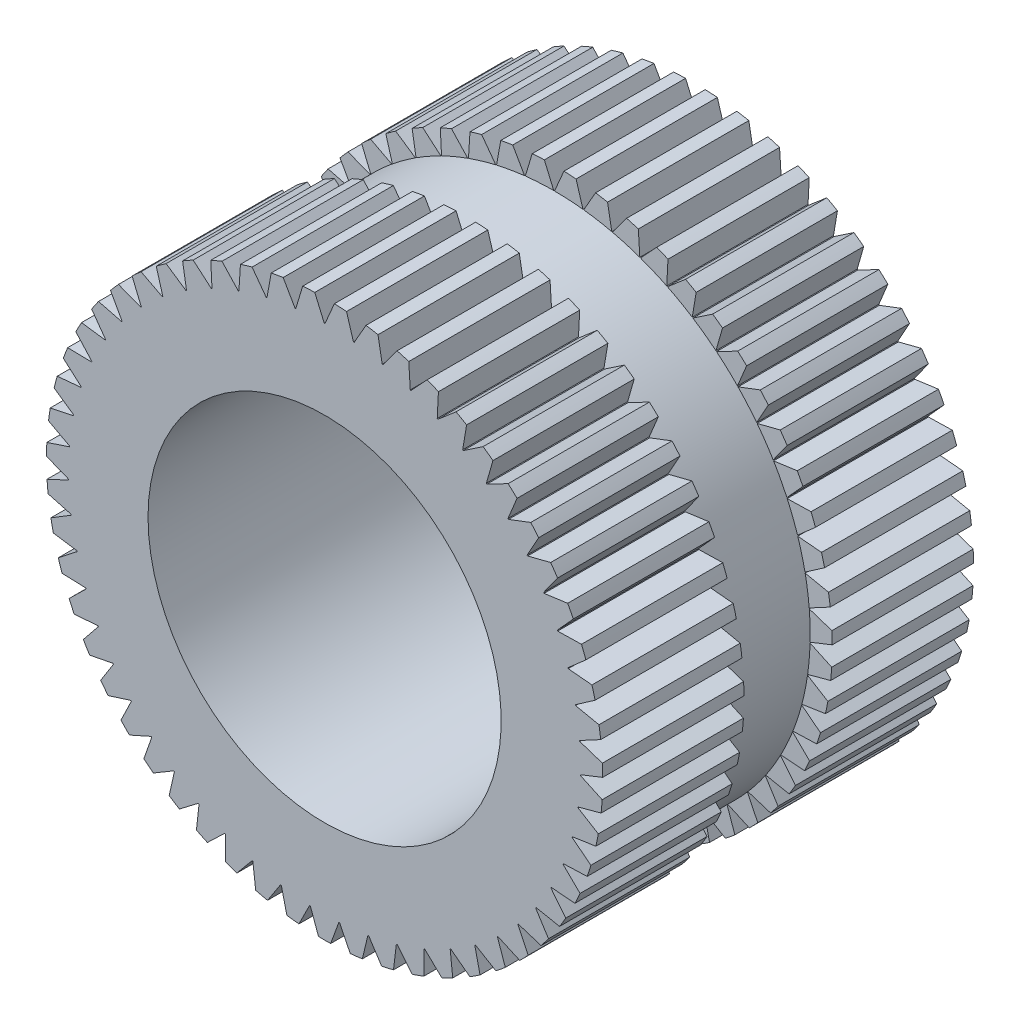
from build123d import *

# Parameters (mm, degrees)
BOSS_EXTRUDE1_DEPTH      = 1.6
SKETCH2_R                = 2.9
BOSS_EXTRUDE2_DEPTH      = 1
BOSS_EXTRUDE3_DEPTH      = 1.6
F_4_0_4_DIAMETER_HOLE1_D = 4


with BuildPart() as part:
    # Sketch1 → Boss-Extrude1 (new body)
    with BuildSketch(Plane.XY.offset(2.1)):
        with BuildLine():
            Line((-2.843098985, 0.571653881), (-3.107391148, 0.516352837))
            ThreePointArc((-3.107391148, 0.516352837), (-3.117937542, 0.448291741), (-3.126993378, 0.380016334))
            Line((-3.126993378, 0.380016334), (-2.888987009, 0.252495664))
            ThreePointArc((-2.888987009, 0.252495664), (-2.88936202, 0.248167525), (-2.889730546, 0.243838828))
            Line((-2.889730546, 0.243838828), (-3.145996138, 0.158771215))
            ThreePointArc((-3.145996138, 0.158771215), (-3.148715407, 0.08995156), (-3.149929405, 0.021088903))
            Line((-3.149929405, 0.021088903), (-2.898938164, -0.078469872))
            ThreePointArc((-2.898938164, -0.078469872), (-2.898817359, -0.082812547), (-2.898690049, -0.087155037))
            Line((-2.898690049, -0.087155037), (-3.143588257, -0.200880234))
            ThreePointArc((-3.143588257, -0.200880234), (-3.138444952, -0.269561277), (-3.131801286, -0.338113454))
            Line((-3.131801286, -0.338113454), (-2.871097227, -0.408412433))
            ThreePointArc((-2.871097227, -0.408412433), (-2.870482181, -0.412713031), (-2.869860694, -0.417012703))
            Line((-2.869860694, -0.417012703), (-3.100198896, -0.557912901))
            ThreePointArc((-3.100198896, -0.557912901), (-3.087260067, -0.62555997), (-3.072845347, -0.692907985))
            Line((-3.072845347, -0.692907985), (-2.805827146, -0.733030713))
            ThreePointArc((-2.805827146, -0.733030713), (-2.804725879, -0.737233169), (-2.803618317, -0.74143397))
            Line((-2.803618317, -0.74143397), (-3.016393701, -0.90767232))
            ThreePointArc((-3.016393701, -0.90767232), (-2.995828026, -0.973403532), (-2.973830169, -1.038669401))
            Line((-2.973830169, -1.038669401), (-2.703978818, -1.048092817))
            ThreePointArc((-2.703978818, -1.048092817), (-2.702405685, -1.052142346), (-2.700826487, -1.056189512))
            Line((-2.700826487, -1.056189512), (-2.893265201, -1.245598842))
            ThreePointArc((-2.893265201, -1.245598842), (-2.865340785, -1.308557291), (-2.836046568, -1.370890172))
            Line((-2.836046568, -1.370890172), (-2.56687999, -1.349491429))
            ThreePointArc((-2.56687999, -1.349491429), (-2.5648555, -1.353335237), (-2.562825254, -1.357176009))
            Line((-2.562825254, -1.357176009), (-2.732418565, -1.567287079))
            ThreePointArc((-2.732418565, -1.567287079), (-2.697499445, -1.626652004), (-2.661290762, -1.685239294))
            Line((-2.661290762, -1.685239294), (-2.396317956, -1.633297356))
            ThreePointArc((-2.396317956, -1.633297356), (-2.393868501, -1.636885335), (-2.391413674, -1.64046964))
            Line((-2.391413674, -1.64046964), (-2.535950674, -1.868543331))
            ThreePointArc((-2.535950674, -1.868543331), (-2.494492075, -1.923540821), (-2.451840962, -1.977618745))
            Line((-2.451840962, -1.977618745), (-2.194516253, -1.895810754))
            ThreePointArc((-2.194516253, -1.895810754), (-2.191673766, -1.899096128), (-2.188826359, -1.902377241))
            Line((-2.188826359, -1.902377241), (-2.306422787, -2.145440264))
            ThreePointArc((-2.306422787, -2.145440264), (-2.258965185, -2.195353341), (-2.210427664, -2.24421691))
            Line((-2.210427664, -2.24421691), (-1.964105675, -2.133609359))
            ThreePointArc((-1.964105675, -2.133609359), (-1.960907211, -2.1365493), (-1.957704346, -2.139484446))
            Line((-1.957704346, -2.139484446), (-2.046827153, -2.394368102))
            ThreePointArc((-2.046827153, -2.394368102), (-1.993989229, -2.438546074), (-1.940198062, -2.481558276))
            Line((-1.940198062, -2.481558276), (-1.708089975, -2.343593104))
            ThreePointArc((-1.708089975, -2.343593104), (-1.704577232, -2.346149284), (-1.701060663, -2.348700198))
            Line((-1.701060663, -2.348700198), (-1.760547996, -2.61208169))
            ThreePointArc((-1.760547996, -2.61208169), (-1.703018575, -2.649948628), (-1.644675011, -2.686548735))
            Line((-1.644675011, -2.686548735), (-1.429806711, -2.523024528))
            ThreePointArc((-1.429806711, -2.523024528), (-1.426025481, -2.525163624), (-1.422241052, -2.527297052))
            Line((-1.422241052, -2.527297052), (-1.451317403, -2.795742798))
            ThreePointArc((-1.451317403, -2.795742798), (-1.389846469, -2.82680505), (-1.327711106, -2.856515923))
            Line((-1.327711106, -2.856515923), (-1.132883729, -2.669564469))
            ThreePointArc((-1.132883729, -2.669564469), (-1.128883308, -2.671258594), (-1.124880354, -2.672946724))
            Line((-1.124880354, -2.672946724), (-1.123166669, -2.942957124))
            ThreePointArc((-1.123166669, -2.942957124), (-1.058555589, -2.966809745), (-0.993438456, -2.989244057))
            Line((-0.993438456, -2.989244057), (-0.821191875, -2.781302555))
            ThreePointArc((-0.821191875, -2.781302555), (-0.817024415, -2.782529623), (-0.812855121, -2.783750447))
            Line((-0.812855121, -2.783750447), (-0.78037374, -3.051805503))
            ThreePointArc((-0.78037374, -3.051805503), (-0.713464817, -3.068137538), (-0.646214817, -3.083002824))
            Line((-0.646214817, -3.083002824), (-0.49879453, -2.856782109))
            ThreePointArc((-0.49879453, -2.856782109), (-0.494514359, -2.857526124), (-0.490233078, -2.858263726))
            Line((-0.490233078, -2.858263726), (-0.427407445, -3.12086893))
            ThreePointArc((-0.427407445, -3.12086893), (-0.359072941, -3.129467466), (-0.290566779, -3.136569933))
            Line((-0.290566779, -3.136569933), (-0.169894635, -2.895019139))
            ThreePointArc((-0.169894635, -2.895019139), (-0.165557552, -2.895270401), (-0.161220097, -2.895515167))
            Line((-0.161220097, -2.895515167), (-0.068869241, -3.149247057))
            ThreePointArc((-0.068869241, -3.149247057), (0, -3.15), (0.068869241, -3.149247057))
            Line((0.068869241, -3.149247057), (0.161220097, -2.895515167))
            ThreePointArc((0.161220097, -2.895515167), (0.165557552, -2.895270401), (0.169894635, -2.895019139))
            Line((0.169894635, -2.895019139), (0.290566779, -3.136569933))
            ThreePointArc((0.290566779, -3.136569933), (0.359072941, -3.129467466), (0.427407445, -3.12086893))
            Line((0.427407445, -3.12086893), (0.490233078, -2.858263726))
            ThreePointArc((0.490233078, -2.858263726), (0.494514359, -2.857526124), (0.49879453, -2.856782109))
            Line((0.49879453, -2.856782109), (0.646214817, -3.083002824))
            ThreePointArc((0.646214817, -3.083002824), (0.713464817, -3.068137538), (0.78037374, -3.051805503))
            Line((0.78037374, -3.051805503), (0.812855121, -2.783750447))
            ThreePointArc((0.812855121, -2.783750447), (0.817024415, -2.782529623), (0.821191875, -2.781302555))
            Line((0.821191875, -2.781302555), (0.993438456, -2.989244057))
            ThreePointArc((0.993438456, -2.989244057), (1.058555589, -2.966809745), (1.123166669, -2.942957124))
            Line((1.123166669, -2.942957124), (1.124880354, -2.672946724))
            ThreePointArc((1.124880354, -2.672946724), (1.128883308, -2.671258594), (1.132883729, -2.669564469))
            Line((1.132883729, -2.669564469), (1.327711106, -2.856515923))
            ThreePointArc((1.327711106, -2.856515923), (1.389846469, -2.82680505), (1.451317403, -2.795742798))
            Line((1.451317403, -2.795742798), (1.422241052, -2.527297052))
            ThreePointArc((1.422241052, -2.527297052), (1.426025481, -2.525163624), (1.429806711, -2.523024528))
            Line((1.429806711, -2.523024528), (1.644675011, -2.686548735))
            ThreePointArc((1.644675011, -2.686548735), (1.703018575, -2.649948628), (1.760547996, -2.61208169))
            Line((1.760547996, -2.61208169), (1.701060663, -2.348700198))
            ThreePointArc((1.701060663, -2.348700198), (1.704577232, -2.346149284), (1.708089975, -2.343593104))
            Line((1.708089975, -2.343593104), (1.940198062, -2.481558276))
            ThreePointArc((1.940198062, -2.481558276), (1.993989229, -2.438546074), (2.046827153, -2.394368102))
            Line((2.046827153, -2.394368102), (1.957704346, -2.139484446))
            ThreePointArc((1.957704346, -2.139484446), (1.960907211, -2.1365493), (1.964105675, -2.133609359))
            Line((1.964105675, -2.133609359), (2.210427664, -2.24421691))
            ThreePointArc((2.210427664, -2.24421691), (2.258965185, -2.195353341), (2.306422787, -2.145440264))
            Line((2.306422787, -2.145440264), (2.188826359, -1.902377241))
            ThreePointArc((2.188826359, -1.902377241), (2.191673766, -1.899096128), (2.194516253, -1.895810754))
            Line((2.194516253, -1.895810754), (2.451840962, -1.977618745))
            ThreePointArc((2.451840962, -1.977618745), (2.494492075, -1.923540821), (2.535950674, -1.868543331))
            Line((2.535950674, -1.868543331), (2.391413674, -1.64046964))
            ThreePointArc((2.391413674, -1.64046964), (2.393868501, -1.636885335), (2.396317956, -1.633297356))
            Line((2.396317956, -1.633297356), (2.661290762, -1.685239294))
            ThreePointArc((2.661290762, -1.685239294), (2.697499445, -1.626652004), (2.732418565, -1.567287079))
            Line((2.732418565, -1.567287079), (2.562825254, -1.357176009))
            ThreePointArc((2.562825254, -1.357176009), (2.5648555, -1.353335237), (2.56687999, -1.349491429))
            Line((2.56687999, -1.349491429), (2.836046568, -1.370890172))
            ThreePointArc((2.836046568, -1.370890172), (2.865340785, -1.308557291), (2.893265201, -1.245598842))
            Line((2.893265201, -1.245598842), (2.700826487, -1.056189512))
            ThreePointArc((2.700826487, -1.056189512), (2.702405685, -1.052142346), (2.703978818, -1.048092817))
            Line((2.703978818, -1.048092817), (2.973830169, -1.038669401))
            ThreePointArc((2.973830169, -1.038669401), (2.995828026, -0.973403532), (3.016393701, -0.90767232))
            Line((3.016393701, -0.90767232), (2.803618317, -0.74143397))
            ThreePointArc((2.803618317, -0.74143397), (2.804725879, -0.737233169), (2.805827146, -0.733030713))
            Line((2.805827146, -0.733030713), (3.072845347, -0.692907985))
            ThreePointArc((3.072845347, -0.692907985), (3.087260067, -0.62555997), (3.100198896, -0.557912901))
            Line((3.100198896, -0.557912901), (2.869860694, -0.417012703))
            ThreePointArc((2.869860694, -0.417012703), (2.870482181, -0.412713031), (2.871097227, -0.408412433))
            Line((2.871097227, -0.408412433), (3.131801286, -0.338113454))
            ThreePointArc((3.131801286, -0.338113454), (3.138444952, -0.269561277), (3.143588257, -0.200880234))
            Line((3.143588257, -0.200880234), (2.898690049, -0.087155037))
            ThreePointArc((2.898690049, -0.087155037), (2.898817359, -0.082812547), (2.898938164, -0.078469872))
            Line((2.898938164, -0.078469872), (3.149929405, 0.021088903))
            ThreePointArc((3.149929405, 0.021088903), (3.148715407, 0.08995156), (3.145996138, 0.158771215))
            Line((3.145996138, 0.158771215), (2.889730546, 0.243838828))
            ThreePointArc((2.889730546, 0.243838828), (2.88936202, 0.248167525), (2.888987009, 0.252495664))
            Line((2.888987009, 0.252495664), (3.126993378, 0.380016334))
            ThreePointArc((3.126993378, 0.380016334), (3.117937542, 0.448291741), (3.107391148, 0.516352837))
            Line((3.107391148, 0.516352837), (2.843098985, 0.571653881))
            ThreePointArc((2.843098985, 0.571653881), (2.842239427, 0.575912353), (2.841373491, 0.580169533))
            Line((2.841373491, 0.580169533), (3.06329221, 0.733989671))
            ThreePointArc((3.06329221, 0.733989671), (3.046512592, 0.800787753), (3.028276562, 0.867203011))
            Line((3.028276562, 0.867203011), (2.759403282, 0.892016552))
            ThreePointArc((2.759403282, 0.892016552), (2.758063897, 0.896149284), (2.756718323, 0.900280005))
            Line((2.756718323, 0.900280005), (2.959656343, 1.07839433))
            ThreePointArc((2.959656343, 1.07839433), (2.935371692, 1.142844272), (2.90968376, 1.206747867))
            Line((2.90968376, 1.206747867), (2.639734537, 1.200750422))
            ThreePointArc((2.639734537, 1.200750422), (2.637932787, 1.204703538), (2.636125117, 1.20865395))
            Line((2.636125117, 1.20865395), (2.81743683, 1.40874047))
            ThreePointArc((2.81743683, 1.40874047), (2.785963733, 1.470002068), (2.753158781, 1.530560919))
            Line((2.753158781, 1.530560919), (2.485652815, 1.493830675))
            ThreePointArc((2.485652815, 1.493830675), (2.483412188, 1.497552639), (2.481165988, 1.501271242))
            Line((2.481165988, 1.501271242), (2.638487718, 1.720721523))
            ThreePointArc((2.638487718, 1.720721523), (2.600236475, 1.777996139), (2.560742166, 1.834420769))
            Line((2.560742166, 1.834420769), (2.299166807, 1.76743656))
            ThreePointArc((2.299166807, 1.76743656), (2.296516513, 1.770878851), (2.293861066, 1.774317168))
            Line((2.293861066, 1.774317168), (2.425141885, 2.01027034))
            ThreePointArc((2.425141885, 2.01027034), (2.380611159, 2.062811312), (2.334942361, 2.114366139))
            Line((2.334942361, 2.114366139), (2.082707644, 2.018001207))
            ThreePointArc((2.082707644, 2.018001207), (2.079682234, 2.021118949), (2.076652157, 2.024232156))
            Line((2.076652157, 2.024232156), (2.180180618, 2.273612208))
            ThreePointArc((2.180180618, 2.273612208), (2.129950936, 2.320734584), (2.078703012, 2.366747513))
            Line((2.078703012, 2.366747513), (1.839097202, 2.242258121))
            ThreePointArc((1.839097202, 2.242258121), (1.835736116, 2.245010671), (1.832370911, 2.247758182))
            Line((1.832370911, 2.247758182), (1.906797362, 2.507314065))
            ThreePointArc((1.906797362, 2.507314065), (1.851523545, 2.548403532), (1.79536459, 2.588274713))
            Line((1.79536459, 2.588274713), (1.571511315, 2.437283773))
            ThreePointArc((1.571511315, 2.437283773), (1.567858371, 2.439635245), (1.564201908, 2.441981243))
            Line((1.564201908, 2.441981243), (1.608556087, 2.708329248))
            ThreePointArc((1.608556087, 2.708329248), (1.548958713, 2.742850143), (1.488620844, 2.776059794))
            Line((1.488620844, 2.776059794), (1.283438375, 2.600535702))
            ThreePointArc((1.283438375, 2.600535702), (1.279541194, 2.602455443), (1.275641141, 2.604369344))
            Line((1.275641141, 2.604369344), (1.289344824, 2.874037217))
            ThreePointArc((1.289344824, 2.874037217), (1.226200835, 2.901539507), (1.16247065, 2.927654691))
            Line((1.16247065, 2.927654691), (0.978633852, 2.729885672))
            ThreePointArc((0.978633852, 2.729885672), (0.97454324, 2.731348655), (0.970450441, 2.732805507))
            Line((0.970450441, 2.732805507), (0.953324978, 3.002277716))
            ThreePointArc((0.953324978, 3.002277716), (0.887457554, 3.022402867), (0.821165873, 3.041083131))
            Line((0.821165873, 3.041083131), (0.661071341, 2.823647407))
            ThreePointArc((0.661071341, 2.823647407), (0.656840626, 2.824634559), (0.652608436, 2.825615372))
            Line((0.652608436, 2.825615372), (0.604877084, 3.091378934))
            ThreePointArc((0.604877084, 3.091378934), (0.537144907, 3.103864583), (0.469155943, 3.114866402))
            Line((0.469155943, 3.114866402), (0.334890754, 2.880598581))
            ThreePointArc((0.334890754, 2.880598581), (0.330575089, 2.881097033), (0.326258681, 2.881589019))
            Line((0.326258681, 2.881589019), (0.248543692, 3.1401793))
            ThreePointArc((0.248543692, 3.1401793), (0.179829754, 3.144862677), (0.111029847, 3.148042626))
            Line((0.111029847, 3.148042626), (0.004344354, 2.899996746))
            ThreePointArc((0.004344354, 2.899996746), (0, 2.9), (-0.004344354, 2.899996746))
            Line((-0.004344354, 2.899996746), (-0.111029847, 3.148042626))
            ThreePointArc((-0.111029847, 3.148042626), (-0.179829754, 3.144862677), (-0.248543692, 3.1401793))
            Line((-0.248543692, 3.1401793), (-0.326258681, 2.881589019))
            ThreePointArc((-0.326258681, 2.881589019), (-0.330575089, 2.881097033), (-0.334890754, 2.880598581))
            Line((-0.334890754, 2.880598581), (-0.469155943, 3.114866402))
            ThreePointArc((-0.469155943, 3.114866402), (-0.537144907, 3.103864583), (-0.604877084, 3.091378934))
            Line((-0.604877084, 3.091378934), (-0.652608436, 2.825615372))
            ThreePointArc((-0.652608436, 2.825615372), (-0.656840626, 2.824634559), (-0.661071341, 2.823647407))
            Line((-0.661071341, 2.823647407), (-0.821165873, 3.041083131))
            ThreePointArc((-0.821165873, 3.041083131), (-0.887457554, 3.022402867), (-0.953324978, 3.002277716))
            Line((-0.953324978, 3.002277716), (-0.970450441, 2.732805507))
            ThreePointArc((-0.970450441, 2.732805507), (-0.97454324, 2.731348655), (-0.978633852, 2.729885672))
            Line((-0.978633852, 2.729885672), (-1.16247065, 2.927654691))
            ThreePointArc((-1.16247065, 2.927654691), (-1.226200835, 2.901539507), (-1.289344824, 2.874037217))
            Line((-1.289344824, 2.874037217), (-1.275641141, 2.604369344))
            ThreePointArc((-1.275641141, 2.604369344), (-1.279541194, 2.602455443), (-1.283438375, 2.600535702))
            Line((-1.283438375, 2.600535702), (-1.488620844, 2.776059794))
            ThreePointArc((-1.488620844, 2.776059794), (-1.548958713, 2.742850143), (-1.608556087, 2.708329248))
            Line((-1.608556087, 2.708329248), (-1.564201908, 2.441981243))
            ThreePointArc((-1.564201908, 2.441981243), (-1.567858371, 2.439635245), (-1.571511315, 2.437283773))
            Line((-1.571511315, 2.437283773), (-1.79536459, 2.588274713))
            ThreePointArc((-1.79536459, 2.588274713), (-1.851523545, 2.548403532), (-1.906797362, 2.507314065))
            Line((-1.906797362, 2.507314065), (-1.832370911, 2.247758182))
            ThreePointArc((-1.832370911, 2.247758182), (-1.835736116, 2.245010671), (-1.839097202, 2.242258121))
            Line((-1.839097202, 2.242258121), (-2.078703012, 2.366747513))
            ThreePointArc((-2.078703012, 2.366747513), (-2.129950936, 2.320734584), (-2.180180618, 2.273612208))
            Line((-2.180180618, 2.273612208), (-2.076652157, 2.024232156))
            ThreePointArc((-2.076652157, 2.024232156), (-2.079682234, 2.021118949), (-2.082707644, 2.018001207))
            Line((-2.082707644, 2.018001207), (-2.334942361, 2.114366139))
            ThreePointArc((-2.334942361, 2.114366139), (-2.380611159, 2.062811312), (-2.425141885, 2.01027034))
            Line((-2.425141885, 2.01027034), (-2.293861066, 1.774317168))
            ThreePointArc((-2.293861066, 1.774317168), (-2.296516513, 1.770878851), (-2.299166807, 1.76743656))
            Line((-2.299166807, 1.76743656), (-2.560742166, 1.834420769))
            ThreePointArc((-2.560742166, 1.834420769), (-2.600236475, 1.777996139), (-2.638487718, 1.720721523))
            Line((-2.638487718, 1.720721523), (-2.481165988, 1.501271242))
            ThreePointArc((-2.481165988, 1.501271242), (-2.483412188, 1.497552639), (-2.485652815, 1.493830675))
            Line((-2.485652815, 1.493830675), (-2.753158781, 1.530560919))
            ThreePointArc((-2.753158781, 1.530560919), (-2.785963733, 1.470002068), (-2.81743683, 1.40874047))
            Line((-2.81743683, 1.40874047), (-2.636125117, 1.20865395))
            ThreePointArc((-2.636125117, 1.20865395), (-2.637932787, 1.204703538), (-2.639734537, 1.200750422))
            Line((-2.639734537, 1.200750422), (-2.90968376, 1.206747867))
            ThreePointArc((-2.90968376, 1.206747867), (-2.935371692, 1.142844272), (-2.959656343, 1.07839433))
            Line((-2.959656343, 1.07839433), (-2.756718323, 0.900280005))
            ThreePointArc((-2.756718323, 0.900280005), (-2.758063897, 0.896149284), (-2.759403282, 0.892016552))
            Line((-2.759403282, 0.892016552), (-3.028276562, 0.867203011))
            ThreePointArc((-3.028276562, 0.867203011), (-3.046512592, 0.800787753), (-3.06329221, 0.733989671))
            Line((-3.06329221, 0.733989671), (-2.841373491, 0.580169533))
            ThreePointArc((-2.841373491, 0.580169533), (-2.842239427, 0.575912353), (-2.843098985, 0.571653881))
        make_face()
    extrude(amount=-BOSS_EXTRUDE1_DEPTH)

    # Sketch2 → Boss-Extrude2 (add)
    with BuildSketch(Plane(origin=(0, 0, 0.5), x_dir=(-1, 0, 0), z_dir=(0, 0, -1))):
        Circle(SKETCH2_R)
    extrude(amount=BOSS_EXTRUDE2_DEPTH)

    # Sketch3 → Boss-Extrude3 (add)
    with BuildSketch(Plane(origin=(0, 0, -0.5), x_dir=(-1, 0, 0), z_dir=(0, 0, -1))):
        with BuildLine():
            Line((2.639734537, 1.200750422), (2.90968376, 1.206747867))
            ThreePointArc((2.90968376, 1.206747867), (2.935371692, 1.142844272), (2.959656343, 1.07839433))
            Line((2.959656343, 1.07839433), (2.756718323, 0.900280005))
            ThreePointArc((2.756718323, 0.900280005), (2.758063897, 0.896149284), (2.759403282, 0.892016552))
            Line((2.759403282, 0.892016552), (3.028276562, 0.867203011))
            ThreePointArc((3.028276562, 0.867203011), (3.046512592, 0.800787753), (3.06329221, 0.733989671))
            Line((3.06329221, 0.733989671), (2.841373491, 0.580169533))
            ThreePointArc((2.841373491, 0.580169533), (2.842239427, 0.575912353), (2.843098985, 0.571653881))
            Line((2.843098985, 0.571653881), (3.107391148, 0.516352837))
            ThreePointArc((3.107391148, 0.516352837), (3.117937542, 0.448291741), (3.126993378, 0.380016334))
            Line((3.126993378, 0.380016334), (2.888987009, 0.252495664))
            ThreePointArc((2.888987009, 0.252495664), (2.88936202, 0.248167525), (2.889730546, 0.243838828))
            Line((2.889730546, 0.243838828), (3.145996138, 0.158771215))
            ThreePointArc((3.145996138, 0.158771215), (3.148715407, 0.08995156), (3.149929405, 0.021088903))
            Line((3.149929405, 0.021088903), (2.898938164, -0.078469872))
            ThreePointArc((2.898938164, -0.078469872), (2.898817359, -0.082812547), (2.898690049, -0.087155037))
            Line((2.898690049, -0.087155037), (3.143588257, -0.200880234))
            ThreePointArc((3.143588257, -0.200880234), (3.138444952, -0.269561277), (3.131801286, -0.338113454))
            Line((3.131801286, -0.338113454), (2.871097227, -0.408412433))
            ThreePointArc((2.871097227, -0.408412433), (2.870482181, -0.412713031), (2.869860694, -0.417012703))
            Line((2.869860694, -0.417012703), (3.100198896, -0.557912901))
            ThreePointArc((3.100198896, -0.557912901), (3.087260067, -0.62555997), (3.072845347, -0.692907985))
            Line((3.072845347, -0.692907985), (2.805827146, -0.733030713))
            ThreePointArc((2.805827146, -0.733030713), (2.804725879, -0.737233169), (2.803618317, -0.74143397))
            Line((2.803618317, -0.74143397), (3.016393701, -0.90767232))
            ThreePointArc((3.016393701, -0.90767232), (2.995828026, -0.973403532), (2.973830169, -1.038669401))
            Line((2.973830169, -1.038669401), (2.703978818, -1.048092817))
            ThreePointArc((2.703978818, -1.048092817), (2.702405685, -1.052142346), (2.700826487, -1.056189512))
            Line((2.700826487, -1.056189512), (2.893265201, -1.245598842))
            ThreePointArc((2.893265201, -1.245598842), (2.865340785, -1.308557291), (2.836046568, -1.370890172))
            Line((2.836046568, -1.370890172), (2.56687999, -1.349491429))
            ThreePointArc((2.56687999, -1.349491429), (2.5648555, -1.353335237), (2.562825254, -1.357176009))
            Line((2.562825254, -1.357176009), (2.732418565, -1.567287079))
            ThreePointArc((2.732418565, -1.567287079), (2.697499445, -1.626652004), (2.661290762, -1.685239294))
            Line((2.661290762, -1.685239294), (2.396317956, -1.633297356))
            ThreePointArc((2.396317956, -1.633297356), (2.393868501, -1.636885335), (2.391413674, -1.64046964))
            Line((2.391413674, -1.64046964), (2.535950674, -1.868543331))
            ThreePointArc((2.535950674, -1.868543331), (2.494492075, -1.923540821), (2.451840962, -1.977618745))
            Line((2.451840962, -1.977618745), (2.194516253, -1.895810754))
            ThreePointArc((2.194516253, -1.895810754), (2.191673766, -1.899096128), (2.188826359, -1.902377241))
            Line((2.188826359, -1.902377241), (2.306422787, -2.145440264))
            ThreePointArc((2.306422787, -2.145440264), (2.258965185, -2.195353341), (2.210427664, -2.24421691))
            Line((2.210427664, -2.24421691), (1.964105675, -2.133609359))
            ThreePointArc((1.964105675, -2.133609359), (1.960907211, -2.1365493), (1.957704346, -2.139484446))
            Line((1.957704346, -2.139484446), (2.046827153, -2.394368102))
            ThreePointArc((2.046827153, -2.394368102), (1.993989229, -2.438546074), (1.940198062, -2.481558276))
            Line((1.940198062, -2.481558276), (1.708089975, -2.343593104))
            ThreePointArc((1.708089975, -2.343593104), (1.704577232, -2.346149284), (1.701060663, -2.348700198))
            Line((1.701060663, -2.348700198), (1.760547996, -2.61208169))
            ThreePointArc((1.760547996, -2.61208169), (1.703018575, -2.649948628), (1.644675011, -2.686548735))
            Line((1.644675011, -2.686548735), (1.429806711, -2.523024528))
            ThreePointArc((1.429806711, -2.523024528), (1.426025481, -2.525163624), (1.422241052, -2.527297052))
            Line((1.422241052, -2.527297052), (1.451317403, -2.795742798))
            ThreePointArc((1.451317403, -2.795742798), (1.389846469, -2.82680505), (1.327711106, -2.856515923))
            Line((1.327711106, -2.856515923), (1.132883729, -2.669564469))
            ThreePointArc((1.132883729, -2.669564469), (1.128883308, -2.671258594), (1.124880354, -2.672946724))
            Line((1.124880354, -2.672946724), (1.123166669, -2.942957124))
            ThreePointArc((1.123166669, -2.942957124), (1.058555589, -2.966809745), (0.993438456, -2.989244057))
            Line((0.993438456, -2.989244057), (0.821191875, -2.781302555))
            ThreePointArc((0.821191875, -2.781302555), (0.817024415, -2.782529623), (0.812855121, -2.783750447))
            Line((0.812855121, -2.783750447), (0.78037374, -3.051805503))
            ThreePointArc((0.78037374, -3.051805503), (0.713464817, -3.068137538), (0.646214817, -3.083002824))
            Line((0.646214817, -3.083002824), (0.49879453, -2.856782109))
            ThreePointArc((0.49879453, -2.856782109), (0.494514359, -2.857526124), (0.490233078, -2.858263726))
            Line((0.490233078, -2.858263726), (0.427407445, -3.12086893))
            ThreePointArc((0.427407445, -3.12086893), (0.359072941, -3.129467466), (0.290566779, -3.136569933))
            Line((0.290566779, -3.136569933), (0.169894635, -2.895019139))
            ThreePointArc((0.169894635, -2.895019139), (0.165557552, -2.895270401), (0.161220097, -2.895515167))
            Line((0.161220097, -2.895515167), (0.068869241, -3.149247057))
            ThreePointArc((0.068869241, -3.149247057), (0, -3.15), (-0.068869241, -3.149247057))
            Line((-0.068869241, -3.149247057), (-0.161220097, -2.895515167))
            ThreePointArc((-0.161220097, -2.895515167), (-0.165557552, -2.895270401), (-0.169894635, -2.895019139))
            Line((-0.169894635, -2.895019139), (-0.290566779, -3.136569933))
            ThreePointArc((-0.290566779, -3.136569933), (-0.359072941, -3.129467466), (-0.427407445, -3.12086893))
            Line((-0.427407445, -3.12086893), (-0.490233078, -2.858263726))
            ThreePointArc((-0.490233078, -2.858263726), (-0.494514359, -2.857526124), (-0.49879453, -2.856782109))
            Line((-0.49879453, -2.856782109), (-0.646214817, -3.083002824))
            ThreePointArc((-0.646214817, -3.083002824), (-0.713464817, -3.068137538), (-0.78037374, -3.051805503))
            Line((-0.78037374, -3.051805503), (-0.812855121, -2.783750447))
            ThreePointArc((-0.812855121, -2.783750447), (-0.817024415, -2.782529623), (-0.821191875, -2.781302555))
            Line((-0.821191875, -2.781302555), (-0.993438456, -2.989244057))
            ThreePointArc((-0.993438456, -2.989244057), (-1.058555589, -2.966809745), (-1.123166669, -2.942957124))
            Line((-1.123166669, -2.942957124), (-1.124880354, -2.672946724))
            ThreePointArc((-1.124880354, -2.672946724), (-1.128883308, -2.671258594), (-1.132883729, -2.669564469))
            Line((-1.132883729, -2.669564469), (-1.327711106, -2.856515923))
            ThreePointArc((-1.327711106, -2.856515923), (-1.389846469, -2.82680505), (-1.451317403, -2.795742798))
            Line((-1.451317403, -2.795742798), (-1.422241052, -2.527297052))
            ThreePointArc((-1.422241052, -2.527297052), (-1.426025481, -2.525163624), (-1.429806711, -2.523024528))
            Line((-1.429806711, -2.523024528), (-1.644675011, -2.686548735))
            ThreePointArc((-1.644675011, -2.686548735), (-1.703018575, -2.649948628), (-1.760547996, -2.61208169))
            Line((-1.760547996, -2.61208169), (-1.701060663, -2.348700198))
            ThreePointArc((-1.701060663, -2.348700198), (-1.704577232, -2.346149284), (-1.708089975, -2.343593104))
            Line((-1.708089975, -2.343593104), (-1.940198062, -2.481558276))
            ThreePointArc((-1.940198062, -2.481558276), (-1.993989229, -2.438546074), (-2.046827153, -2.394368102))
            Line((-2.046827153, -2.394368102), (-1.957704346, -2.139484446))
            ThreePointArc((-1.957704346, -2.139484446), (-1.960907211, -2.1365493), (-1.964105675, -2.133609359))
            Line((-1.964105675, -2.133609359), (-2.210427664, -2.24421691))
            ThreePointArc((-2.210427664, -2.24421691), (-2.258965185, -2.195353341), (-2.306422787, -2.145440264))
            Line((-2.306422787, -2.145440264), (-2.188826359, -1.902377241))
            ThreePointArc((-2.188826359, -1.902377241), (-2.191673766, -1.899096128), (-2.194516253, -1.895810754))
            Line((-2.194516253, -1.895810754), (-2.451840962, -1.977618745))
            ThreePointArc((-2.451840962, -1.977618745), (-2.494492075, -1.923540821), (-2.535950674, -1.868543331))
            Line((-2.535950674, -1.868543331), (-2.391413674, -1.64046964))
            ThreePointArc((-2.391413674, -1.64046964), (-2.393868501, -1.636885335), (-2.396317956, -1.633297356))
            Line((-2.396317956, -1.633297356), (-2.661290762, -1.685239294))
            ThreePointArc((-2.661290762, -1.685239294), (-2.697499445, -1.626652004), (-2.732418565, -1.567287079))
            Line((-2.732418565, -1.567287079), (-2.562825254, -1.357176009))
            ThreePointArc((-2.562825254, -1.357176009), (-2.5648555, -1.353335237), (-2.56687999, -1.349491429))
            Line((-2.56687999, -1.349491429), (-2.836046568, -1.370890172))
            ThreePointArc((-2.836046568, -1.370890172), (-2.865340785, -1.308557291), (-2.893265201, -1.245598842))
            Line((-2.893265201, -1.245598842), (-2.700826487, -1.056189512))
            ThreePointArc((-2.700826487, -1.056189512), (-2.702405685, -1.052142346), (-2.703978818, -1.048092817))
            Line((-2.703978818, -1.048092817), (-2.973830169, -1.038669401))
            ThreePointArc((-2.973830169, -1.038669401), (-2.995828026, -0.973403532), (-3.016393701, -0.90767232))
            Line((-3.016393701, -0.90767232), (-2.803618317, -0.74143397))
            ThreePointArc((-2.803618317, -0.74143397), (-2.804725879, -0.737233169), (-2.805827146, -0.733030713))
            Line((-2.805827146, -0.733030713), (-3.072845347, -0.692907985))
            ThreePointArc((-3.072845347, -0.692907985), (-3.087260067, -0.62555997), (-3.100198896, -0.557912901))
            Line((-3.100198896, -0.557912901), (-2.869860694, -0.417012703))
            ThreePointArc((-2.869860694, -0.417012703), (-2.870482181, -0.412713031), (-2.871097227, -0.408412433))
            Line((-2.871097227, -0.408412433), (-3.131801286, -0.338113454))
            ThreePointArc((-3.131801286, -0.338113454), (-3.138444952, -0.269561277), (-3.143588257, -0.200880234))
            Line((-3.143588257, -0.200880234), (-2.898690049, -0.087155037))
            ThreePointArc((-2.898690049, -0.087155037), (-2.898817359, -0.082812547), (-2.898938164, -0.078469872))
            Line((-2.898938164, -0.078469872), (-3.149929405, 0.021088903))
            ThreePointArc((-3.149929405, 0.021088903), (-3.148715407, 0.08995156), (-3.145996138, 0.158771215))
            Line((-3.145996138, 0.158771215), (-2.889730546, 0.243838828))
            ThreePointArc((-2.889730546, 0.243838828), (-2.88936202, 0.248167525), (-2.888987009, 0.252495664))
            Line((-2.888987009, 0.252495664), (-3.126993378, 0.380016334))
            ThreePointArc((-3.126993378, 0.380016334), (-3.117937542, 0.448291741), (-3.107391148, 0.516352837))
            Line((-3.107391148, 0.516352837), (-2.843098985, 0.571653881))
            ThreePointArc((-2.843098985, 0.571653881), (-2.842239427, 0.575912353), (-2.841373491, 0.580169533))
            Line((-2.841373491, 0.580169533), (-3.06329221, 0.733989671))
            ThreePointArc((-3.06329221, 0.733989671), (-3.046512592, 0.800787753), (-3.028276562, 0.867203011))
            Line((-3.028276562, 0.867203011), (-2.759403282, 0.892016552))
            ThreePointArc((-2.759403282, 0.892016552), (-2.758063897, 0.896149284), (-2.756718323, 0.900280005))
            Line((-2.756718323, 0.900280005), (-2.959656343, 1.07839433))
            ThreePointArc((-2.959656343, 1.07839433), (-2.935371692, 1.142844272), (-2.90968376, 1.206747867))
            Line((-2.90968376, 1.206747867), (-2.639734537, 1.200750422))
            ThreePointArc((-2.639734537, 1.200750422), (-2.637932787, 1.204703538), (-2.636125117, 1.20865395))
            Line((-2.636125117, 1.20865395), (-2.81743683, 1.40874047))
            ThreePointArc((-2.81743683, 1.40874047), (-2.785963733, 1.470002068), (-2.753158781, 1.530560919))
            Line((-2.753158781, 1.530560919), (-2.485652815, 1.493830675))
            ThreePointArc((-2.485652815, 1.493830675), (-2.483412188, 1.497552639), (-2.481165988, 1.501271242))
            Line((-2.481165988, 1.501271242), (-2.638487718, 1.720721523))
            ThreePointArc((-2.638487718, 1.720721523), (-2.600236475, 1.777996139), (-2.560742166, 1.834420769))
            Line((-2.560742166, 1.834420769), (-2.299166807, 1.76743656))
            ThreePointArc((-2.299166807, 1.76743656), (-2.296516513, 1.770878851), (-2.293861066, 1.774317168))
            Line((-2.293861066, 1.774317168), (-2.425141885, 2.01027034))
            ThreePointArc((-2.425141885, 2.01027034), (-2.380611159, 2.062811312), (-2.334942361, 2.114366139))
            Line((-2.334942361, 2.114366139), (-2.082707644, 2.018001207))
            ThreePointArc((-2.082707644, 2.018001207), (-2.079682234, 2.021118949), (-2.076652157, 2.024232156))
            Line((-2.076652157, 2.024232156), (-2.180180618, 2.273612208))
            ThreePointArc((-2.180180618, 2.273612208), (-2.129950936, 2.320734584), (-2.078703012, 2.366747513))
            Line((-2.078703012, 2.366747513), (-1.839097202, 2.242258121))
            ThreePointArc((-1.839097202, 2.242258121), (-1.835736116, 2.245010671), (-1.832370911, 2.247758182))
            Line((-1.832370911, 2.247758182), (-1.906797362, 2.507314065))
            ThreePointArc((-1.906797362, 2.507314065), (-1.851523545, 2.548403532), (-1.79536459, 2.588274713))
            Line((-1.79536459, 2.588274713), (-1.571511315, 2.437283773))
            ThreePointArc((-1.571511315, 2.437283773), (-1.567858371, 2.439635245), (-1.564201908, 2.441981243))
            Line((-1.564201908, 2.441981243), (-1.608556087, 2.708329248))
            ThreePointArc((-1.608556087, 2.708329248), (-1.548958713, 2.742850143), (-1.488620844, 2.776059794))
            Line((-1.488620844, 2.776059794), (-1.283438375, 2.600535702))
            ThreePointArc((-1.283438375, 2.600535702), (-1.279541194, 2.602455443), (-1.275641141, 2.604369344))
            Line((-1.275641141, 2.604369344), (-1.289344824, 2.874037217))
            ThreePointArc((-1.289344824, 2.874037217), (-1.226200835, 2.901539507), (-1.16247065, 2.927654691))
            Line((-1.16247065, 2.927654691), (-0.978633852, 2.729885672))
            ThreePointArc((-0.978633852, 2.729885672), (-0.97454324, 2.731348655), (-0.970450441, 2.732805507))
            Line((-0.970450441, 2.732805507), (-0.953324978, 3.002277716))
            ThreePointArc((-0.953324978, 3.002277716), (-0.887457554, 3.022402867), (-0.821165873, 3.041083131))
            Line((-0.821165873, 3.041083131), (-0.661071341, 2.823647407))
            ThreePointArc((-0.661071341, 2.823647407), (-0.656840626, 2.824634559), (-0.652608436, 2.825615372))
            Line((-0.652608436, 2.825615372), (-0.604877084, 3.091378934))
            ThreePointArc((-0.604877084, 3.091378934), (-0.537144907, 3.103864583), (-0.469155943, 3.114866402))
            Line((-0.469155943, 3.114866402), (-0.334890754, 2.880598581))
            ThreePointArc((-0.334890754, 2.880598581), (-0.330575089, 2.881097033), (-0.326258681, 2.881589019))
            Line((-0.326258681, 2.881589019), (-0.248543692, 3.1401793))
            ThreePointArc((-0.248543692, 3.1401793), (-0.179829754, 3.144862677), (-0.111029847, 3.148042626))
            Line((-0.111029847, 3.148042626), (-0.004344354, 2.899996746))
            ThreePointArc((-0.004344354, 2.899996746), (0, 2.9), (0.004344354, 2.899996746))
            Line((0.004344354, 2.899996746), (0.111029847, 3.148042626))
            ThreePointArc((0.111029847, 3.148042626), (0.179829754, 3.144862677), (0.248543692, 3.1401793))
            Line((0.248543692, 3.1401793), (0.326258681, 2.881589019))
            ThreePointArc((0.326258681, 2.881589019), (0.330575089, 2.881097033), (0.334890754, 2.880598581))
            Line((0.334890754, 2.880598581), (0.469155943, 3.114866402))
            ThreePointArc((0.469155943, 3.114866402), (0.537144907, 3.103864583), (0.604877084, 3.091378934))
            Line((0.604877084, 3.091378934), (0.652608436, 2.825615372))
            ThreePointArc((0.652608436, 2.825615372), (0.656840626, 2.824634559), (0.661071341, 2.823647407))
            Line((0.661071341, 2.823647407), (0.821165873, 3.041083131))
            ThreePointArc((0.821165873, 3.041083131), (0.887457554, 3.022402867), (0.953324978, 3.002277716))
            Line((0.953324978, 3.002277716), (0.970450441, 2.732805507))
            ThreePointArc((0.970450441, 2.732805507), (0.97454324, 2.731348655), (0.978633852, 2.729885672))
            Line((0.978633852, 2.729885672), (1.16247065, 2.927654691))
            ThreePointArc((1.16247065, 2.927654691), (1.226200835, 2.901539507), (1.289344824, 2.874037217))
            Line((1.289344824, 2.874037217), (1.275641141, 2.604369344))
            ThreePointArc((1.275641141, 2.604369344), (1.279541194, 2.602455443), (1.283438375, 2.600535702))
            Line((1.283438375, 2.600535702), (1.488620844, 2.776059794))
            ThreePointArc((1.488620844, 2.776059794), (1.548958713, 2.742850143), (1.608556087, 2.708329248))
            Line((1.608556087, 2.708329248), (1.564201908, 2.441981243))
            ThreePointArc((1.564201908, 2.441981243), (1.567858371, 2.439635245), (1.571511315, 2.437283773))
            Line((1.571511315, 2.437283773), (1.79536459, 2.588274713))
            ThreePointArc((1.79536459, 2.588274713), (1.851523545, 2.548403532), (1.906797362, 2.507314065))
            Line((1.906797362, 2.507314065), (1.832370911, 2.247758182))
            ThreePointArc((1.832370911, 2.247758182), (1.835736116, 2.245010671), (1.839097202, 2.242258121))
            Line((1.839097202, 2.242258121), (2.078703012, 2.366747513))
            ThreePointArc((2.078703012, 2.366747513), (2.129950936, 2.320734584), (2.180180618, 2.273612208))
            Line((2.180180618, 2.273612208), (2.076652157, 2.024232156))
            ThreePointArc((2.076652157, 2.024232156), (2.079682234, 2.021118949), (2.082707644, 2.018001207))
            Line((2.082707644, 2.018001207), (2.334942361, 2.114366139))
            ThreePointArc((2.334942361, 2.114366139), (2.380611159, 2.062811312), (2.425141885, 2.01027034))
            Line((2.425141885, 2.01027034), (2.293861066, 1.774317168))
            ThreePointArc((2.293861066, 1.774317168), (2.296516513, 1.770878851), (2.299166807, 1.76743656))
            Line((2.299166807, 1.76743656), (2.560742166, 1.834420769))
            ThreePointArc((2.560742166, 1.834420769), (2.600236475, 1.777996139), (2.638487718, 1.720721523))
            Line((2.638487718, 1.720721523), (2.481165988, 1.501271242))
            ThreePointArc((2.481165988, 1.501271242), (2.483412188, 1.497552639), (2.485652815, 1.493830675))
            Line((2.485652815, 1.493830675), (2.753158781, 1.530560919))
            ThreePointArc((2.753158781, 1.530560919), (2.785963733, 1.470002068), (2.81743683, 1.40874047))
            Line((2.81743683, 1.40874047), (2.636125117, 1.20865395))
            ThreePointArc((2.636125117, 1.20865395), (2.637932787, 1.204703538), (2.639734537, 1.200750422))
        make_face()
    extrude(amount=BOSS_EXTRUDE3_DEPTH)

    # Ø4.0 (4) Diameter Hole1 (through all)
    with Locations(Plane(origin=(0, 0, -2.1), x_dir=(-1, 0, 0), z_dir=(0, 0, -1))):
        with Locations((0, 0)):
            Hole(F_4_0_4_DIAMETER_HOLE1_D / 2)


solid = part.part
